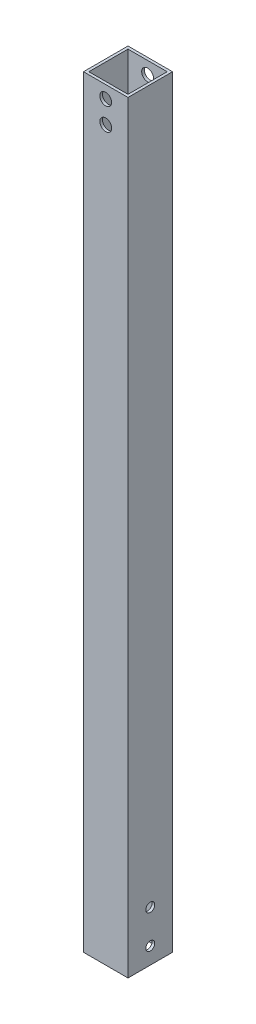
from build123d import *

# Parameters (mm, degrees)
SKETCH1_W               = 25.4
SKETCH1_H               = 25.4
SKETCH1_W_2             = 22.352
SKETCH1_H_2             = 22.352
EXTRUDE_THIN1_DEPTH     = 434.975
F_1_4_CLEARANCE_HOLE1_D = 6.7564
F_10_CLEARANCE_HOLE1_D  = 5.1054


with BuildPart() as part:
    # Sketch1 → Extrude-Thin1 (new body)
    with BuildSketch(Plane(origin=(0, 0, 0), x_dir=(1, 0, 0), z_dir=(0, 1, 0))):
        Rectangle(SKETCH1_W, SKETCH1_H)
        Rectangle(SKETCH1_W_2, SKETCH1_H_2, mode=Mode.SUBTRACT)
    extrude(amount=EXTRUDE_THIN1_DEPTH)

    # 1/4 Clearance Hole1 (through all)
    with Locations(Plane(origin=(0, 0, -12.7), x_dir=(-1, 0, 0), z_dir=(0, 0, -1))):
        with Locations((0, 427.7995), (0, 415.0995)):
            Hole(F_1_4_CLEARANCE_HOLE1_D / 2)

    # #10 Clearance Hole1 (through all)
    with Locations(Plane(origin=(12.7, 0, 0), x_dir=(0, 0, -1), z_dir=(1, 0, 0))):
        with Locations((0, 9.525), (0, 28.575)):
            Hole(F_10_CLEARANCE_HOLE1_D / 2)


solid = part.part
